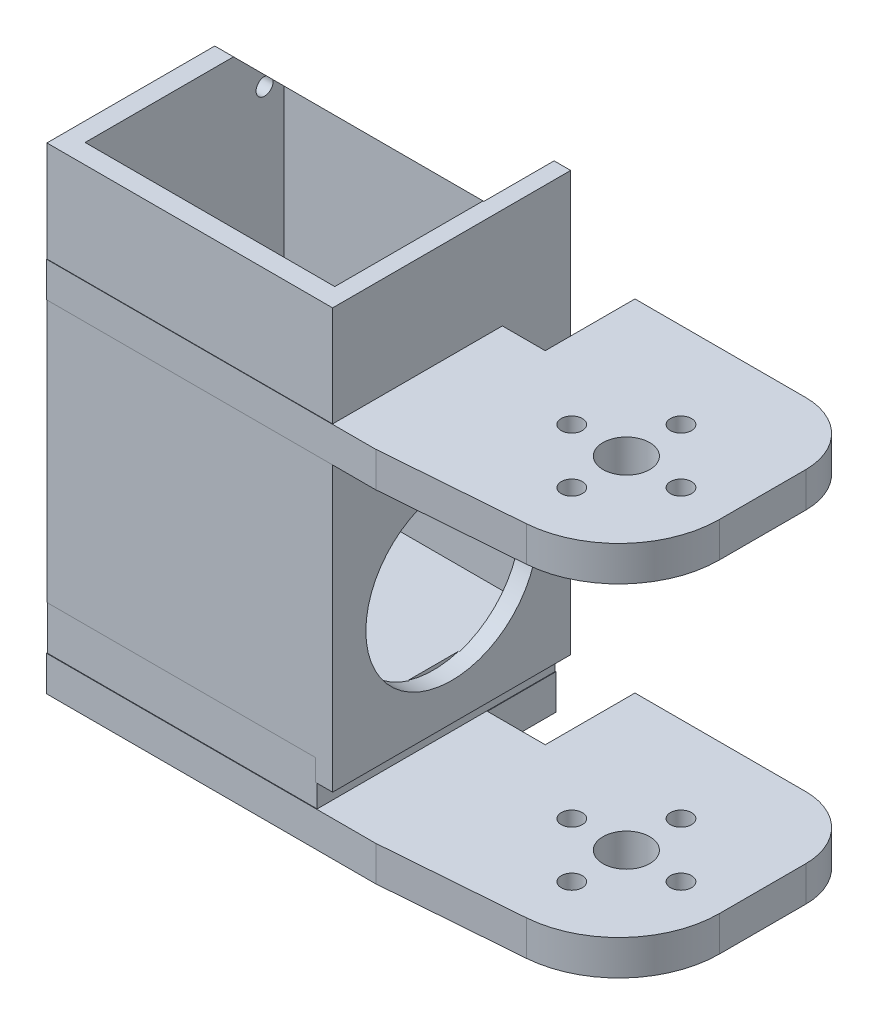
from build123d import *

# Parameters (mm, degrees)
BOSS_1_DEPTH  = 4.5
S_CYL2_R      = 9
BOSS_2_DEPTH  = 2
BOSS_3_DEPTH  = 4.5
S_PRISM4_W    = 7.775
S_PRISM4_H    = 21.81
BOSS_4_DEPTH  = 4.5
S_PRISM5_W    = 42.225
S_PRISM5_H    = 2.6
BOSS_5_DEPTH  = 4.5
S_PRISM6_W    = 34.7
S_PRISM6_H    = 30.62
BOSS_6_DEPTH  = 4.5
S_PRISM7_W    = 7.775
S_PRISM7_H    = 21.81
BOSS_7_DEPTH  = 4.5
S_PRISM8_W    = 42.225
S_PRISM8_H    = 2.6
BOSS_8_DEPTH  = 4.5
S_BOX9_W      = 34.4
S_BOX9_H      = 2.5
BOSS_9_DEPTH  = 30.52
S_BOX10_W     = 34.4
S_BOX10_H     = 51.02
BOSS_10_DEPTH = 2.5
S_BOX11_W     = 34.4
S_BOX11_H     = 51.02
BOSS_11_DEPTH = 2.5
S_BOX12_W     = 2.4
S_BOX12_H     = 51.02
BOSS_12_DEPTH = 30.52
S_BOX13_W     = 2.225
S_BOX13_H     = 53.77
BOSS_13_DEPTH = 30.52
S_BOX14_W     = 34.56
S_BOX14_H     = 5.825
BOSS_14_DEPTH = 30.48
S_HOLE15_R    = 3
HOLE_15_DEPTH = 4.7
S_HOLE16_R    = 1.35
HOLE_16_DEPTH = 4.7
S_HOLE17_R    = 1.35
HOLE_17_DEPTH = 4.7
S_HOLE18_R    = 1.35
HOLE_18_DEPTH = 4.7
S_HOLE19_R    = 1.35
HOLE_19_DEPTH = 4.7
S_HOLE20_R    = 3
HOLE_20_DEPTH = 6.7
S_HOLE21_R    = 1.35
HOLE_21_DEPTH = 6.7
S_HOLE22_R    = 1.35
HOLE_22_DEPTH = 6.7
S_HOLE23_R    = 1.35
HOLE_23_DEPTH = 6.7
S_HOLE24_R    = 1.35
HOLE_24_DEPTH = 6.7
S_HOLE25_R    = 11
HOLE_25_DEPTH = 2.6
S_HOLE26_R    = 1.1
HOLE_26_DEPTH = 2.6
S_HOLE27_R    = 1.1
HOLE_27_DEPTH = 2.6
S_HOLE28_R    = 1.1
HOLE_28_DEPTH = 2.6
S_HOLE29_R    = 11
HOLE_29_DEPTH = 2.425
CUT_30_DEPTH  = 34.6


with BuildPart() as part:
    # S_prism1 → Boss_1 (new body)
    with BuildSketch(Plane(origin=(0, -23.125, 0), x_dir=(1, 0, 0), z_dir=(0, 1, 0))):
        with BuildLine():
            Line((13, 10), (13, -1.0582))
            ThreePointArc((13, -1.0582), (9.566483076, -9.821518282), (1.0937, -13.9199))
            Line((1.0937, -13.9199), (-16.9, -15.31))
            Line((-16.9, -15.31), (-16.9, 18))
            Line((-16.9, 18), (5, 18))
            ThreePointArc((5, 18), (10.6569, 15.6569), (13, 10))
        make_face()
    extrude(amount=BOSS_1_DEPTH)

    # S_prism4 → Boss_4 (add)
    with BuildSketch(Plane(origin=(0, -23.125, 0), x_dir=(1, 0, 0), z_dir=(0, 1, 0))):
        with Locations((-20.6875, -4.405)):
            Rectangle(S_PRISM4_W, S_PRISM4_H)
    extrude(amount=BOSS_4_DEPTH)

    # S_prism5 → Boss_5 (add)
    with BuildSketch(Plane(origin=(0, -23.125, 0), x_dir=(1, 0, 0), z_dir=(0, 1, 0))):
        with Locations((-37.9125, -14.01)):
            Rectangle(S_PRISM5_W, S_PRISM5_H)
    extrude(amount=BOSS_5_DEPTH)

    # S_prism6 → Boss_6 (add)
    with BuildSketch(Plane(origin=(0, -23.125, 0), x_dir=(1, 0, 0), z_dir=(0, 1, 0))):
        with Locations((-41.675, 0)):
            Rectangle(S_PRISM6_W, S_PRISM6_H)
    extrude(amount=BOSS_6_DEPTH)



with BuildPart() as body_2:
    # S_cyl2 → Boss_2 (new body)
    with BuildSketch(Plane(origin=(0, 18.625, 0), x_dir=(1, 0, 0), z_dir=(0, 1, 0))):
        Circle(S_CYL2_R)
    extrude(amount=BOSS_2_DEPTH)

    # S_prism3 → Boss_3 (add)
    with BuildSketch(Plane(origin=(0, 20.625, 0), x_dir=(1, 0, 0), z_dir=(0, 1, 0))):
        with BuildLine():
            Line((13, 10), (13, -1.0582))
            ThreePointArc((13, -1.0582), (9.566483076, -9.821518282), (1.0937, -13.9199))
            Line((1.0937, -13.9199), (-16.9, -15.31))
            Line((-16.9, -15.31), (-16.9, 18))
            Line((-16.9, 18), (5, 18))
            ThreePointArc((5, 18), (10.6569, 15.6569), (13, 10))
        make_face()
    extrude(amount=BOSS_3_DEPTH)

    # S_prism7 → Boss_7 (add)
    with BuildSketch(Plane(origin=(0, 20.625, 0), x_dir=(1, 0, 0), z_dir=(0, 1, 0))):
        with Locations((-20.6875, -4.405)):
            Rectangle(S_PRISM7_W, S_PRISM7_H)
    extrude(amount=BOSS_7_DEPTH)

    # S_prism8 → Boss_8 (add)
    with BuildSketch(Plane(origin=(0, 20.625, 0), x_dir=(1, 0, 0), z_dir=(0, 1, 0))):
        with Locations((-37.9125, -14.01)):
            Rectangle(S_PRISM8_W, S_PRISM8_H)
    extrude(amount=BOSS_8_DEPTH)



with BuildPart() as body_3:
    # S_box9 → Boss_9 (new body)
    with BuildSketch(Plane.XY.offset(-15.26)):
        with Locations((-41.825, -11.76)):
            Rectangle(S_BOX9_W, S_BOX9_H)
    extrude(amount=BOSS_9_DEPTH)

    # S_box10 → Boss_10 (add)
    with BuildSketch(Plane.XY.offset(-15.26)):
        with Locations((-41.825, 12.5)):
            Rectangle(S_BOX10_W, S_BOX10_H)
    extrude(amount=BOSS_10_DEPTH)


with BuildPart() as body_2_1:
    add(body_2.part)

    add(body_3.part)  # Boss_11 merges body 3
    # S_box11 → Boss_11 (add)
    with BuildSketch(Plane.XY.offset(12.76)):
        with Locations((-41.825, 12.5)):
            Rectangle(S_BOX11_W, S_BOX11_H)
    extrude(amount=BOSS_11_DEPTH)

    # S_box12 → Boss_12 (add)
    with BuildSketch(Plane.XY.offset(-15.26)):
        with Locations((-57.825, 12.5)):
            Rectangle(S_BOX12_W, S_BOX12_H)
    extrude(amount=BOSS_12_DEPTH)

    # S_box13 → Boss_13 (add)
    with BuildSketch(Plane.XY.offset(-15.26)):
        with Locations((-23.5125, 11.125)):
            Rectangle(S_BOX13_W, S_BOX13_H)
    extrude(amount=BOSS_13_DEPTH)


with BuildPart() as part_1:
    add(part.part)

    add(body_2_1.part)  # Boss_14 merges body 2
    # S_box14 → Boss_14 (add)
    with BuildSketch(Plane.XY.offset(-15.24)):
        with Locations((-41.675, -15.8125)):
            Rectangle(S_BOX14_W, S_BOX14_H)
    extrude(amount=BOSS_14_DEPTH)

    # S_hole15 → Hole_15 (cut)
    with BuildSketch(Plane(origin=(0, -23.225, 0), x_dir=(1, 0, 0), z_dir=(0, 1, 0))):
        Circle(S_HOLE15_R)
    extrude(amount=HOLE_15_DEPTH, mode=Mode.SUBTRACT)

    # S_hole16 → Hole_16 (cut)
    with BuildSketch(Plane(origin=(0, -23.225, 0), x_dir=(1, 0, 0), z_dir=(0, 1, 0))):
        with Locations((7, 0)):
            Circle(S_HOLE16_R)
    extrude(amount=HOLE_16_DEPTH, mode=Mode.SUBTRACT)

    # S_hole17 → Hole_17 (cut)
    with BuildSketch(Plane(origin=(0, -23.225, 0), x_dir=(1, 0, 0), z_dir=(0, 1, 0))):
        with Locations((0, -7)):
            Circle(S_HOLE17_R)
    extrude(amount=HOLE_17_DEPTH, mode=Mode.SUBTRACT)

    # S_hole18 → Hole_18 (cut)
    with BuildSketch(Plane(origin=(0, -23.225, 0), x_dir=(1, 0, 0), z_dir=(0, 1, 0))):
        with Locations((-7, 0)):
            Circle(S_HOLE18_R)
    extrude(amount=HOLE_18_DEPTH, mode=Mode.SUBTRACT)

    # S_hole19 → Hole_19 (cut)
    with BuildSketch(Plane(origin=(0, -23.225, 0), x_dir=(1, 0, 0), z_dir=(0, 1, 0))):
        with Locations((0, 7)):
            Circle(S_HOLE19_R)
    extrude(amount=HOLE_19_DEPTH, mode=Mode.SUBTRACT)

    # S_hole20 → Hole_20 (cut)
    with BuildSketch(Plane(origin=(0, 18.525, 0), x_dir=(1, 0, 0), z_dir=(0, 1, 0))):
        Circle(S_HOLE20_R)
    extrude(amount=HOLE_20_DEPTH, mode=Mode.SUBTRACT)

    # S_hole21 → Hole_21 (cut)
    with BuildSketch(Plane(origin=(0, 18.525, 0), x_dir=(1, 0, 0), z_dir=(0, 1, 0))):
        with Locations((7, 0)):
            Circle(S_HOLE21_R)
    extrude(amount=HOLE_21_DEPTH, mode=Mode.SUBTRACT)

    # S_hole22 → Hole_22 (cut)
    with BuildSketch(Plane(origin=(0, 18.525, 0), x_dir=(1, 0, 0), z_dir=(0, 1, 0))):
        with Locations((0, -7)):
            Circle(S_HOLE22_R)
    extrude(amount=HOLE_22_DEPTH, mode=Mode.SUBTRACT)

    # S_hole23 → Hole_23 (cut)
    with BuildSketch(Plane(origin=(0, 18.525, 0), x_dir=(1, 0, 0), z_dir=(0, 1, 0))):
        with Locations((-7, 0)):
            Circle(S_HOLE23_R)
    extrude(amount=HOLE_23_DEPTH, mode=Mode.SUBTRACT)

    # S_hole24 → Hole_24 (cut)
    with BuildSketch(Plane(origin=(0, 18.525, 0), x_dir=(1, 0, 0), z_dir=(0, 1, 0))):
        with Locations((0, 7)):
            Circle(S_HOLE24_R)
    extrude(amount=HOLE_24_DEPTH, mode=Mode.SUBTRACT)

    # S_hole25 → Hole_25 (cut)
    with BuildSketch(Plane(origin=(-59.125, 0, 0), x_dir=(0, 0, -1), z_dir=(1, 0, 0))):
        Circle(S_HOLE25_R)
    extrude(amount=HOLE_25_DEPTH, mode=Mode.SUBTRACT)

    # S_hole26 → Hole_26 (cut)
    with BuildSketch(Plane(origin=(-59.125, 0, 0), x_dir=(0, 0, -1), z_dir=(1, 0, 0))):
        with Locations((-10.25, 8.3)):
            Circle(S_HOLE26_R)
    extrude(amount=HOLE_26_DEPTH, mode=Mode.SUBTRACT)

    # S_hole27 → Hole_27 (cut)
    with BuildSketch(Plane(origin=(-59.125, 0, 0), x_dir=(0, 0, -1), z_dir=(1, 0, 0))):
        with Locations((10.25, 32.75)):
            Circle(S_HOLE27_R)
    extrude(amount=HOLE_27_DEPTH, mode=Mode.SUBTRACT)

    # S_hole28 → Hole_28 (cut)
    with BuildSketch(Plane(origin=(-59.125, 0, 0), x_dir=(0, 0, -1), z_dir=(1, 0, 0))):
        with Locations((-10.25, 32.75)):
            Circle(S_HOLE28_R)
    extrude(amount=HOLE_28_DEPTH, mode=Mode.SUBTRACT)

    # S_hole29 → Hole_29 (cut)
    with BuildSketch(Plane(origin=(-24.725, 0, 0), x_dir=(0, 0, -1), z_dir=(1, 0, 0))):
        Circle(S_HOLE29_R)
    extrude(amount=HOLE_29_DEPTH, mode=Mode.SUBTRACT)

    # S_pcut30 → Cut_30 (cut)
    with BuildSketch(Plane(origin=(-59.125, 0, 0), x_dir=(0, 0, -1), z_dir=(1, 0, 0))):
        Polygon((15.86, 38.61), (15.86, 28.41), (5.66, 38.61), align=None)
    extrude(amount=CUT_30_DEPTH, mode=Mode.SUBTRACT)


solid = part_1.part
